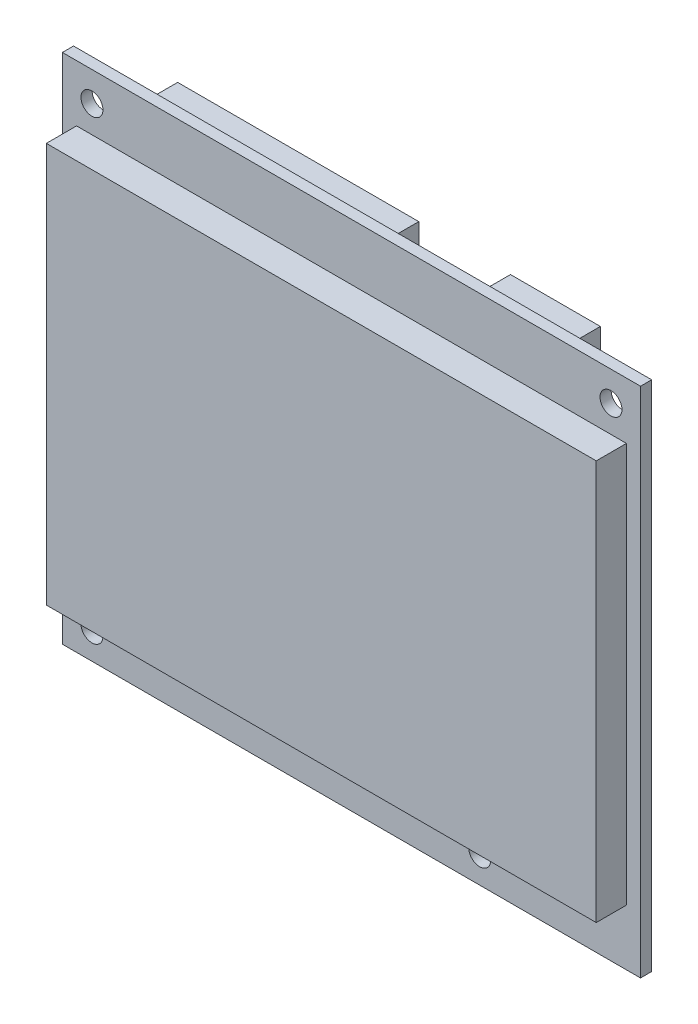
from build123d import *

# Parameters (mm, degrees)
SKETCH1_W           = 81.6864
SKETCH1_H           = 72.4154
BOSS_EXTRUDE1_DEPTH = 1.5748
SKETCH2_W           = 77.7
SKETCH2_H           = 56.5
BOSS_EXTRUDE2_DEPTH = 4.27
SKETCH4_R           = 1.55
CUT_EXTRUDE1_DEPTH  = 58.189442313
SKETCH3_W           = 12.7
SKETCH3_H           = 5.08
SKETCH3_W_2         = 34.071115987
BOSS_EXTRUDE3_DEPTH = 5.08
SKETCH5_W           = 11.143297124
SKETCH5_H           = 14.820585176
BOSS_EXTRUDE4_DEPTH = 2


with BuildPart() as part:
    # Sketch1 → Boss-Extrude1 (new body)
    with BuildSketch(Plane(origin=(0, 0, 0), x_dir=(-1, 0, 0), z_dir=(0, 0, -1))):
        with Locations((2.8568, -0.2173)):
            Rectangle(SKETCH1_W, SKETCH1_H)
    extrude(amount=BOSS_EXTRUDE1_DEPTH)

    # Sketch2 → Boss-Extrude2 (add)
    with BuildSketch(Plane(origin=(0, 0, 0), x_dir=(-1, 0, 0), z_dir=(0, 0, -1))):
        with Locations((2.85, -0.25)):
            Rectangle(SKETCH2_W, SKETCH2_H)
    extrude(amount=-BOSS_EXTRUDE2_DEPTH)

    # Sketch4 → Cut-Extrude1 (cut, through all)
    with BuildSketch(Plane(origin=(0, 0, -1.5748), x_dir=(-1, 0, 0), z_dir=(0, 0, -1))):
        with Locations((39.525, 31.8154)):
            Circle(SKETCH4_R)
        with Locations((39.525, -32.625)):
            Circle(SKETCH4_R)
        with Locations((-15.2614, -32.625)):
            Circle(SKETCH4_R)
        with Locations((-33.8114, 31.8154)):
            Circle(SKETCH4_R)
    extrude(amount=-CUT_EXTRUDE1_DEPTH, mode=Mode.SUBTRACT)

    # Sketch3 → Boss-Extrude3 (add)
    with BuildSketch(Plane.XY.offset(-1.5748)):
        with Locations((19.31004682, 31.274104804)):
            Rectangle(SKETCH3_W, SKETCH3_H)
        with Locations((-17.035557993, 31.274104804)):
            Rectangle(SKETCH3_W_2, SKETCH3_H)
        with Locations((-17.035557993, -31.699250815)):
            Rectangle(SKETCH3_W_2, SKETCH3_H)
    extrude(amount=-BOSS_EXTRUDE3_DEPTH)

    # Sketch5 → Boss-Extrude4 (add)
    with BuildSketch(Plane(origin=(0, 0, -1.5748), x_dir=(-1, 0, 0), z_dir=(0, 0, -1))):
        Polygon((19.476551601, 13.535617464), (30.731281697, 2.280887368), (19.476551601, -8.973842728), (8.221821505, 2.280887368), align=None)
        with Locations((-21.419348846, -17.387032057)):
            Rectangle(SKETCH5_W, SKETCH5_H)
    extrude(amount=BOSS_EXTRUDE4_DEPTH)


solid = part.part
